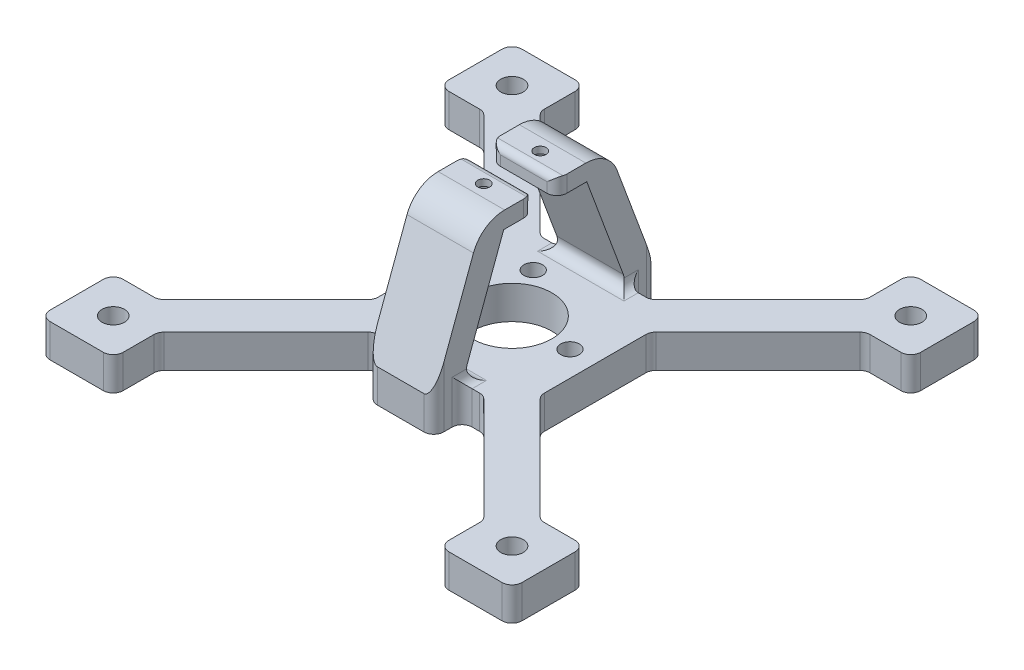
from build123d import *

# Parameters (mm, degrees)
SKETCH1_W                                       = 22
SKETCH1_H                                       = 22
BOSS_EXTRUDE1_DEPTH                             = 10
F_1_4_CLEARANCE_HOLE1_D                         = 6.7564
SKETCH6_R                                       = 4
CUT_EXTRUDE1_DEPTH                              = 207.717198123
SKETCH7_R                                       = 12
CUT_EXTRUDE2_DEPTH                              = 207.717198123
CBORE_FOR_10_SOCKET_HEAD_CAP_SCREW1_D           = 5.6134
CBORE_FOR_10_SOCKET_HEAD_CAP_SCREW1_CBORE_D     = 9.525
CBORE_FOR_10_SOCKET_HEAD_CAP_SCREW1_CBORE_DEPTH = 4.826
BOSS_EXTRUDE2_DEPTH                             = 10
BOSS_EXTRUDE2_DEPTH_BACK                        = 10
CBORE_FOR_M3_SHCS1_D                            = 3.6
CBORE_FOR_M3_SHCS1_CBORE_D                      = 6.5
CBORE_FOR_M3_SHCS1_CBORE_DEPTH                  = 3
FILLET1_R                                       = 3
FILLET2_R                                       = 3
FILLET3_R                                       = 10
FILLET4_R                                       = 2


with BuildPart() as part:
    # Sketch1 → Boss-Extrude1 (new body)
    with BuildSketch(Plane(origin=(0, 0, 0), x_dir=(1, 0, 0), z_dir=(0, 1, 0))):
        with Locations((15, 15)):
            Rectangle(SKETCH1_W, SKETCH1_H)
        Polygon((50, 50), (50, 58.485281374), (17.514718626, 26), (26, 26), (26, 17.514718626), (58.485281374, 50), align=None)
        Polygon((50, 75), (50, 100), (75, 100), (100, 100), (100, 50), (75, 50), (50, 50), align=None)
        Polygon((100, 50), (91.514718626, 50), (124, 17.514718626), (124, 26), (132.485281374, 26), (100, 58.485281374), align=None)
        with Locations((135, 15)):
            Rectangle(SKETCH1_W, SKETCH1_H)
        with Locations((135, 135)):
            Rectangle(SKETCH1_W, SKETCH1_H)
        Polygon((124, 132.485281374), (91.514718626, 100), (100, 100), (100, 91.514718626), (132.485281374, 124), (124, 124), align=None)
        Polygon((17.514718626, 124), (50, 91.514718626), (50, 100), (58.485281374, 100), (26, 132.485281374), (26, 124), align=None)
        with Locations((15, 135)):
            Rectangle(SKETCH1_W, SKETCH1_H)
    extrude(amount=-BOSS_EXTRUDE1_DEPTH)

    # 1/4 Clearance Hole1 (through all)
    with Locations(Plane(origin=(0, 0, 0), x_dir=(1, 0, 0), z_dir=(0, 1, 0))):
        with Locations((15, 15), (15, 135), (135, 135), (135, 15)):
            Hole(F_1_4_CLEARANCE_HOLE1_D / 2)

    # Sketch6 → Cut-Extrude1 (cut, through all)
    with BuildSketch(Plane.XZ.offset(10)):
        with Locations(Location((75, -75, 0), (0, 0, 270))):
            Circle(SKETCH6_R)
    extrude(amount=-CUT_EXTRUDE1_DEPTH, mode=Mode.SUBTRACT)

    # Sketch7 → Cut-Extrude2 (cut, through all)
    with BuildSketch(Plane(origin=(0, -10, 0), x_dir=(1, 0, 0), z_dir=(0, 1, 0))):
        with Locations(Location((75, 75, 0), (0, 0, 270))):
            Circle(SKETCH7_R)
    extrude(amount=CUT_EXTRUDE2_DEPTH, mode=Mode.SUBTRACT)

    # CBORE for #10 Socket Head Cap Screw1 (through all)
    with Locations(Plane(origin=(0, -10, 0), x_dir=(-1, 0, 0), z_dir=(0, -1, 0))):
        with Locations((-92.45, 75), (-66.275, 59.887856704), (-66.275, 90.112143296)):
            CounterBoreHole(CBORE_FOR_10_SOCKET_HEAD_CAP_SCREW1_D / 2, CBORE_FOR_10_SOCKET_HEAD_CAP_SCREW1_CBORE_D / 2, CBORE_FOR_10_SOCKET_HEAD_CAP_SCREW1_CBORE_DEPTH)

    # Sketch10 → Boss-Extrude2 (add, two sides: drawn at the far end of the back side and taken through both)
    with BuildSketch(Plane.ZY.offset(-75).offset(-BOSS_EXTRUDE2_DEPTH_BACK)):
        Polygon((-100, -10), (-100, 0), (-87.5, 33.704367651), (-78.5, 33.704367651), (-78.5, 38.704367651), (-87.5, 38.704367651), (-94.178104684, 38.704367651), (-108.532463759, 0), (-108.532463759, -10), align=None)
        Polygon((-71.5, 33.704367651), (-71.5, 38.704367651), (-62.5, 38.704367651), (-55.821895316, 38.704367651), (-41.467536241, 0), (-41.467536241, -10), (-50, -10), (-50, 0), (-62.5, 33.704367651), align=None)
    extrude(amount=BOSS_EXTRUDE2_DEPTH + BOSS_EXTRUDE2_DEPTH_BACK)

    # CBORE for M3 SHCS1 (through all)
    with Locations(Plane(origin=(0, 33.704367651, 0), x_dir=(-1, 0, 0), z_dir=(0, -1, 0))):
        with Locations((-75, 83.5), (-75, 66.5)):
            CounterBoreHole(CBORE_FOR_M3_SHCS1_D / 2, CBORE_FOR_M3_SHCS1_CBORE_D / 2, CBORE_FOR_M3_SHCS1_CBORE_DEPTH)

    # Fillet1
    fillet1_edges = [part.edges().sort_by_distance(p)[0] for p in [
        (85, -5, -108.532463759),
        (85, 36.204367651, -78.5),
        (85, -5, -100),
        (65, -5, -100),
        (65, 36.204367651, -78.5),
        (65, -5, -108.532463759),
        (85, -5, -50),
        (85, 36.204367651, -71.5),
        (85, -5, -41.467536241),
        (65, -5, -41.467536241),
        (65, 36.204367651, -71.5),
        (65, -5, -50),
        (100, -5, -58.485281374),
        (132.485281374, -5, -26),
        (146, -5, -26),
        (146, -5, -4),
        (124, -5, -4),
        (124, -5, -17.514718626),
        (91.514718626, -5, -50),
        (58.485281374, -5, -50),
        (26, -5, -17.514718626),
        (26, -5, -4),
        (4, -5, -4),
        (4, -5, -26),
        (17.514718626, -5, -26),
        (50, -5, -58.485281374),
        (50, -5, -91.514718626),
        (17.514718626, -5, -124),
        (4, -5, -124),
        (4, -5, -146),
        (26, -5, -146),
        (26, -5, -132.485281374),
        (58.485281374, -5, -100),
        (91.514718626, -5, -100),
        (124, -5, -132.485281374),
        (124, -5, -146),
        (146, -5, -146),
        (146, -5, -124),
        (132.485281374, -5, -124),
        (100, -5, -91.514718626),
    ]]
    fillet(fillet1_edges, radius=FILLET1_R)

    # Fillet2
    fillet2_edges = [part.edges().sort_by_distance(p)[0] for p in [
        (85, 0, -48.5),
        (85, 0, -101.5),
        (65, 0, -48.5),
        (65, 0, -101.5),
        (75, 0, -50),
        (75, 0, -100),
    ]]
    fillet(fillet2_edges, radius=FILLET2_R)

    # Fillet3
    fillet3_edges = [part.edges().sort_by_distance(p)[0] for p in [
        (75, 38.704367651, -94.178104684),
        (75, 38.704367651, -55.821895316),
    ]]
    fillet(fillet3_edges, radius=FILLET3_R)

    # Fillet4
    # the kernel refuses this fillet: 2 mm, written as the material it takes off along each edge
    with BuildSketch(Plane(origin=(63, 38.704367651, -71.5), x_dir=(0, 0, 1), z_dir=(1, 0, 0)), Plane(origin=(87, 38.704367651, -78.5), x_dir=(0, 0, -1), z_dir=(-1, 0, 0))) as fillet4_piece_1:
        with BuildLine():
            CenterArc((FILLET4_R, FILLET4_R), FILLET4_R, 180, 90)
            Line((0, FILLET4_R), (0, 0))
            Line((0, 0), (FILLET4_R, 0))
        make_face()
    extrude(amount=24, mode=Mode.SUBTRACT)


solid = part.part
